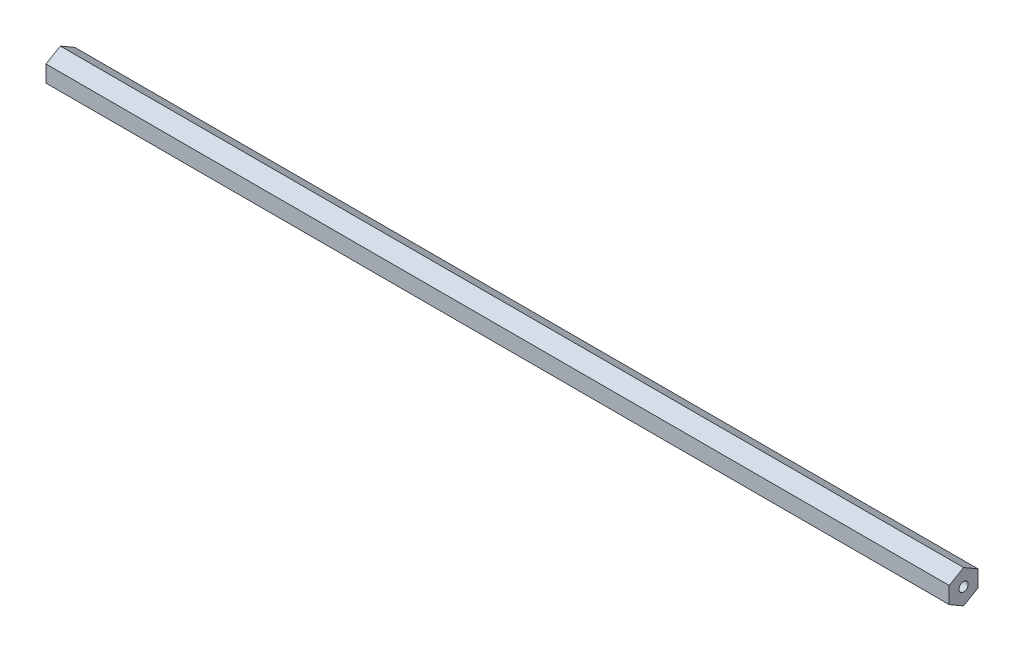
from build123d import *

# Parameters (mm, degrees)
BOSS_EXTRUDE1_DEPTH                  = 199.263
F_10_32_TAPPED_HOLE2_D               = 4.0386
F_10_32_TAPPED_HOLE2_DEPTH           = 16.34744
F_10_32_TAPPED_HOLE2_TIP             = 1.213317848
F_10_32_TAPPED_HOLE2_ON_FACE_2_D     = 4.0386
F_10_32_TAPPED_HOLE2_ON_FACE_2_DEPTH = 16.34744
F_10_32_TAPPED_HOLE2_ON_FACE_2_TIP   = 1.213317848


with BuildPart() as part:
    # Sketch1 → Boss-Extrude1 (new, symmetric)
    with BuildSketch(Plane(origin=(0, 0, 0), x_dir=(0, 0, -1), z_dir=(1, 0, 0))):
        Polygon((6.35, 3.666174209), (0, 7.332348419), (-6.35, 3.666174209), (-6.35, -3.666174209), (0, -7.332348419), (6.35, -3.666174209), align=None)
    extrude(amount=BOSS_EXTRUDE1_DEPTH, both=True)

    # #10-32 Tapped Hole2
    with Locations(Plane(origin=(199.263, 0, 0), x_dir=(0, 0, 1), z_dir=(1, 0, 0))):
        with Locations((0, 0)):
            Hole(F_10_32_TAPPED_HOLE2_D / 2, depth=F_10_32_TAPPED_HOLE2_DEPTH)
            with Locations((0, 0, -(F_10_32_TAPPED_HOLE2_DEPTH + F_10_32_TAPPED_HOLE2_TIP / 2))):  # 118° drill point
                Cone(0, F_10_32_TAPPED_HOLE2_D / 2, F_10_32_TAPPED_HOLE2_TIP, mode=Mode.SUBTRACT)

    # #10-32 Tapped Hole2 on face 2
    with Locations(Plane(origin=(-199.263, 0, 0), x_dir=(0, 0, -1), z_dir=(-1, 0, 0))):
        with Locations((0, 0)):
            Hole(F_10_32_TAPPED_HOLE2_ON_FACE_2_D / 2, depth=F_10_32_TAPPED_HOLE2_ON_FACE_2_DEPTH)
            with Locations((0, 0, -(F_10_32_TAPPED_HOLE2_ON_FACE_2_DEPTH + F_10_32_TAPPED_HOLE2_ON_FACE_2_TIP / 2))):  # 118° drill point
                Cone(0, F_10_32_TAPPED_HOLE2_ON_FACE_2_D / 2, F_10_32_TAPPED_HOLE2_ON_FACE_2_TIP, mode=Mode.SUBTRACT)


solid = part.part
